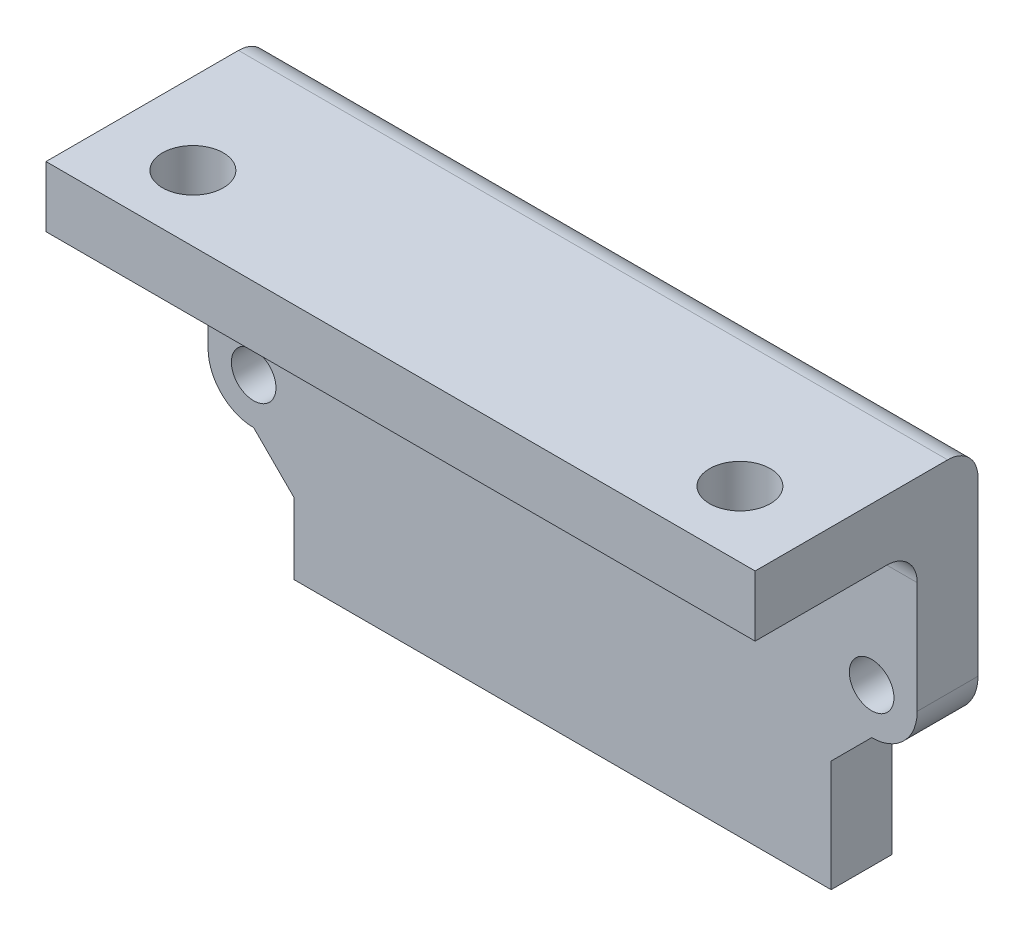
from build123d import *

# Parameters (mm, degrees)
SKETCH_1_R          = 1.1
EXTRUDE_1_DEPTH     = 3
SKETCH_2_W          = 35
SKETCH_2_H          = 11
EXTRUDE_2_DEPTH     = 3
FILLET_1_R          = 1.5
SKETCH_3_R          = 1.5
CUT_EXTRUDE_1_DEPTH = 3


with BuildPart() as part:
    # 草图1 → 凸台-拉伸1 (new body)
    with BuildSketch(Plane.XY):
        with BuildLine():
            Line((-13.25, -8.125), (13.25, -8.125))
            Line((13.25, -8.125), (13.25, -2.625))
            Line((13.25, -2.625), (15.25, -0.625))
            ThreePointArc((15.25, -0.625), (16.840990258, 0.034009742), (17.5, 1.625))
            Line((17.5, 1.625), (17.5, 8.625))
            Line((17.5, 8.625), (13.25, 8.625))
            Line((13.25, 8.625), (-13.25, 8.625))
            Line((-13.25, 8.625), (-17.5, 8.625))
            Line((-17.5, 8.625), (-17.5, -0.375))
            ThreePointArc((-17.5, -0.375), (-16.840990258, -1.965990258), (-15.25, -2.625))
            Line((-15.25, -2.625), (-13.25, -4.625))
            Line((-13.25, -4.625), (-13.25, -8.125))
        make_face()
        with Locations((-15.25, -0.375)):
            Circle(SKETCH_1_R, mode=Mode.SUBTRACT)
        with Locations((15.25, 1.625)):
            Circle(SKETCH_1_R, mode=Mode.SUBTRACT)
    extrude(amount=EXTRUDE_1_DEPTH)

    # 草图2 → 凸台-拉伸2 (add)
    with BuildSketch(Plane(origin=(0, 8.625, 0), x_dir=(1, 0, 0), z_dir=(0, 1, 0))):
        with Locations((0, -5.5)):
            Rectangle(SKETCH_2_W, SKETCH_2_H)
    extrude(amount=EXTRUDE_2_DEPTH)

    # 圆角1
    fillet_1_edges = [part.edges().sort_by_distance(p)[0] for p in [
        (0, 8.625, 3),
        (0, 11.625, 0),
    ]]
    fillet(fillet_1_edges, radius=FILLET_1_R)

    # 草图3 → 切除-拉伸1 (cut)
    with BuildSketch(Plane.XZ.offset(-8.625)):
        with Locations((13.5, 7.75)):
            Circle(SKETCH_3_R)
        with Locations((-13.5, 7.75)):
            Circle(SKETCH_3_R)
    extrude(amount=-CUT_EXTRUDE_1_DEPTH, mode=Mode.SUBTRACT)


solid = part.part
